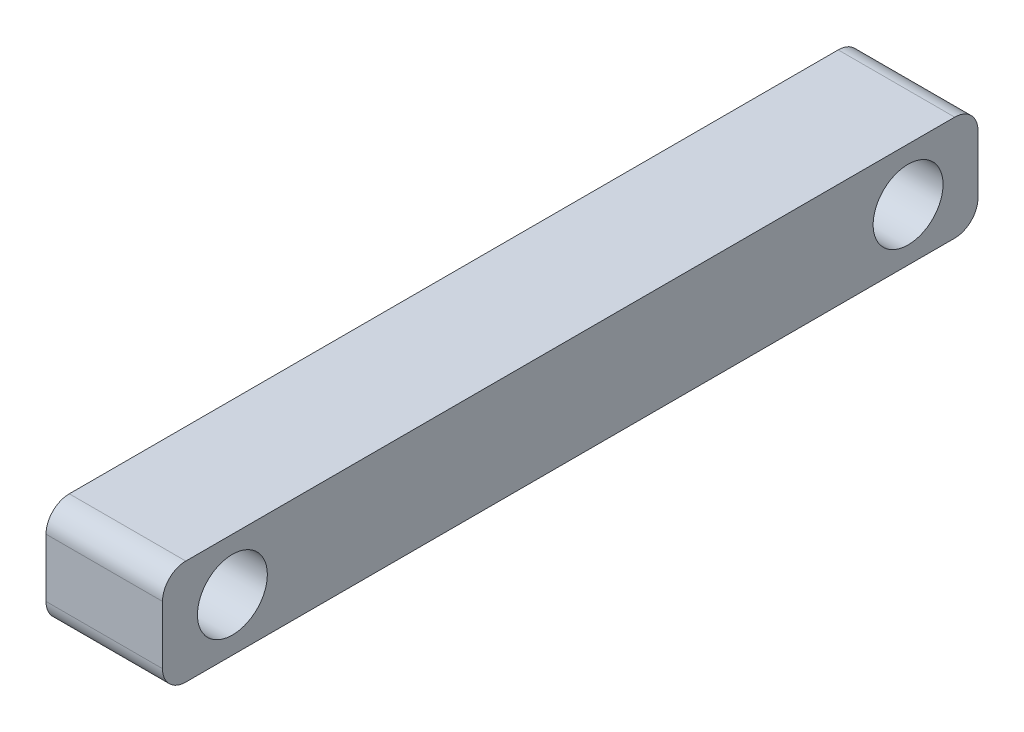
from build123d import *

# Parameters (mm, degrees)
SALIENTE_EXTRUIR1_DEPTH    = 2.5
CORTAR_EXTRUIR1_DEPTH      = 18.820283387
CORTAR_EXTRUIR1_DEPTH_BACK = 18.820283387
CROQUIS2_R                 = 1.5


with BuildPart() as part:
    # Croquis1 → Saliente-Extruir1 (new, symmetric)
    with BuildSketch(Plane(origin=(0, 0, 0), x_dir=(0, 0, -1), z_dir=(1, 0, 0))):
        with BuildLine():
            Line((-16.5, 2.25), (16.5, 2.25))
            ThreePointArc((16.5, 2.25), (17.207106781, 1.957106781), (17.5, 1.25))
            Line((17.5, 1.25), (17.5, -1.25))
            ThreePointArc((17.5, -1.25), (17.207106781, -1.957106781), (16.5, -2.25))
            Line((16.5, -2.25), (-16.5, -2.25))
            ThreePointArc((-16.5, -2.25), (-17.207106781, -1.957106781), (-17.5, -1.25))
            Line((-17.5, -1.25), (-17.5, 1.25))
            ThreePointArc((-17.5, 1.25), (-17.207106781, 1.957106781), (-16.5, 2.25))
        make_face()
    extrude(amount=SALIENTE_EXTRUIR1_DEPTH, both=True)

    # Croquis2 → Cortar-Extruir1 (cut, two sides: drawn at the far end of the back side and taken through both)
    with BuildSketch(Plane(origin=(0, 0, 0), x_dir=(0, 0, -1), z_dir=(1, 0, 0)).offset(-CORTAR_EXTRUIR1_DEPTH_BACK)):
        with Locations((-14.5, 0)):
            Circle(CROQUIS2_R)
        with Locations((14.5, 0)):
            Circle(CROQUIS2_R)
    extrude(amount=CORTAR_EXTRUIR1_DEPTH + CORTAR_EXTRUIR1_DEPTH_BACK, mode=Mode.SUBTRACT)


solid = part.part
